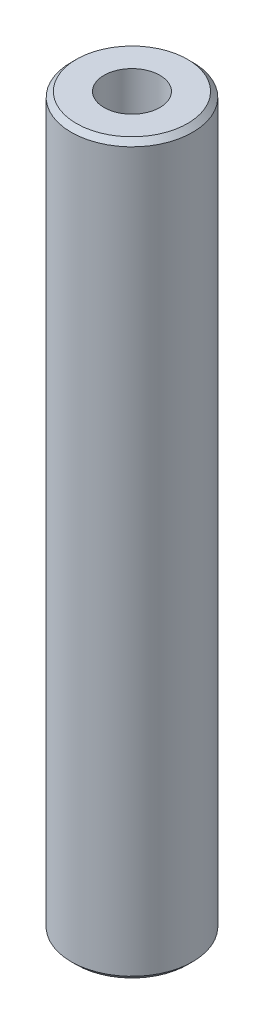
from build123d import *

# Parameters (mm, degrees)
SKETCH1_R           = 50
BOSS_EXTRUDE1_DEPTH = 600
SKETCH2_R           = 23.015642375
CUT_EXTRUDE1_DEPTH  = 605.15229868
CHAMFER1_SIZE       = 4.203818372


with BuildPart() as part:
    # Sketch1 → Boss-Extrude1 (new body)
    with BuildSketch(Plane(origin=(0, 0, 0), x_dir=(1, 0, 0), z_dir=(0, 1, 0))):
        Circle(SKETCH1_R)
    extrude(amount=BOSS_EXTRUDE1_DEPTH)

    # Sketch2 → Cut-Extrude1 (cut, through all)
    with BuildSketch(Plane(origin=(0, 0, 0), x_dir=(1, 0, 0), z_dir=(0, 1, 0))):
        Circle(SKETCH2_R)
    extrude(amount=CUT_EXTRUDE1_DEPTH, mode=Mode.SUBTRACT)

    # Chamfer1
    chamfer1_edges = [part.edges().sort_by_distance(p)[0] for p in [
        (-50, 600, 0),
        (-50, 0, 0),
    ]]
    chamfer(chamfer1_edges, length=CHAMFER1_SIZE)


solid = part.part
